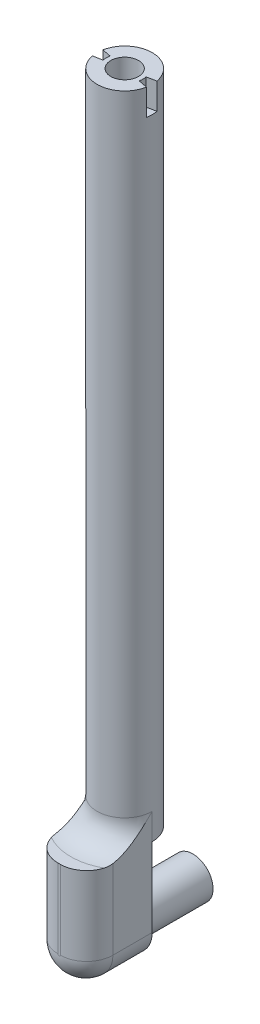
from build123d import *
from build123d.topology import SkipClean

# Parameters (mm, degrees)
SKETCH3_R           = 5.25
BOSS_EXTRUDE1_DEPTH = 120
BOSS_EXTRUDE4_DEPTH = 12.5
SKETCH6_R           = 3.85
BOSS_EXTRUDE5_DEPTH = 13
FILLET3_R           = 5
FILLET4_R           = 5
SKETCH7_R           = 2.65
CUT_EXTRUDE1_DEPTH  = 8
BOSS_EXTRUDE6_START = 5
BOSS_EXTRUDE6_DEPTH = 5


with BuildPart() as part:
    # Sketch3 → Boss-Extrude1 (new body)
    with BuildSketch(Plane(origin=(0, 0, 0), x_dir=(1, 0, 0), z_dir=(0, 1, 0))):
        with Locations(Location((0, 0, 0), (0, 0, 270))):
            Circle(SKETCH3_R)
    extrude(amount=BOSS_EXTRUDE1_DEPTH)

    # Sketch4 → Boss-Extrude4 (add)
    with BuildSketch(Plane.XY):
        with BuildLine():
            Line((-5.25, 0), (-5.25, -15))
            ThreePointArc((-5.25, -15), (0, -20.25), (5.25, -15))
            Line((5.25, -15), (5.25, 0))
            Line((5.25, 0), (-5.25, 0))
        make_face()
    extrude(amount=BOSS_EXTRUDE4_DEPTH)

    # Sketch6 → Boss-Extrude5 (add)
    with BuildSketch(Plane(origin=(0, 0, 0), x_dir=(-1, 0, 0), z_dir=(0, 0, -1))):
        with Locations(Location((0, -15, 0), (0, 0, 180))):
            Circle(SKETCH6_R)
    extrude(amount=BOSS_EXTRUDE5_DEPTH)

    # Fillet3
    # the kernel refuses this fillet: 5 mm, written as the material it adds along each edge
    with BuildSketch(Plane(origin=(0, 0, 0), x_dir=(0, 0, 1), z_dir=(-1, 0, 0))) as fillet3_piece_1_section:
        with BuildLine():
            CenterArc((5.25 + FILLET3_R, FILLET3_R), FILLET3_R, 180, 90)
            Line((5.25 + FILLET3_R, 0), (5.25, 0))
            Line((5.25, 0), (5.25, FILLET3_R))
        make_face()
    fillet3_piece_1 = revolve(axis=Axis((0, 0, 0), (0, 1, 0)), revolution_arc=90, mode=Mode.PRIVATE)
    fillet3_piece_1 = split(fillet3_piece_1, bisect_by=Plane(origin=(5.25, 1.168711495, 5.202443702), z_dir=(-1, 0, 0)), keep=Keep.TOP, mode=Mode.PRIVATE)
    add(fillet3_piece_1)
    with BuildSketch(Plane(origin=(0, 0, 0), x_dir=(-1, 0, 0), z_dir=(0, 0, -1))) as fillet3_piece_2_section:
        with BuildLine():
            CenterArc((5.25 + FILLET3_R, FILLET3_R), FILLET3_R, 180, 90)
            Line((5.25 + FILLET3_R, 0), (5.25, 0))
            Line((5.25, 0), (5.25, FILLET3_R))
        make_face()
    fillet3_piece_2 = revolve(axis=Axis((0, 0, 0), (0, 1, 0)), revolution_arc=90, mode=Mode.PRIVATE)
    fillet3_piece_2 = split(fillet3_piece_2, bisect_by=Plane(origin=(-5.25, 1.168711696, 5.202443347), z_dir=(1, 0, 0)), keep=Keep.TOP, mode=Mode.PRIVATE)
    add(fillet3_piece_2)

    # Fillet4
    fillet4_edges = [part.edges().sort_by_distance(p)[0] for p in [
        (5.25, -7.5, 12.5),
        (0, -20.25, 12.5),
        (-5.25, -7.5, 12.5),
    ]]
    fillet(fillet4_edges, radius=FILLET4_R)

    # Sketch7 → Cut-Extrude1 (cut)
    with BuildSketch(Plane(origin=(0, 120, 0), x_dir=(1, 0, 0), z_dir=(0, 1, 0))):
        with Locations(Location((0, 0, 0), (0, 0, 270))):
            Circle(SKETCH7_R)
    extrude(amount=-CUT_EXTRUDE1_DEPTH, mode=Mode.SUBTRACT)

    # Sketch9 → Boss-Extrude6 (add)
    with SkipClean():  # the faces are left unmerged after this step: merging them gives an invalid solid
        with BuildSketch(Plane(origin=(0, 120, 0), x_dir=(1, 0, 0), z_dir=(0, 1, 0)).offset(BOSS_EXTRUDE6_START)):
            with BuildLine():
                Line((-3.435921355, 0.666666667), (-5.153882032, 1))
                ThreePointArc((-5.153882032, 1), (0, 5.25), (5.153882032, 1))
                Line((5.153882032, 1), (3.435921355, 0.666666667))
                ThreePointArc((3.435921355, 0.666666667), (3.5, 0), (3.435921355, -0.666666667))
                Line((3.435921355, -0.666666667), (5.153882032, -1))
                ThreePointArc((5.153882032, -1), (0, -5.25), (-5.153882032, -1))
                Line((-5.153882032, -1), (-3.435921355, -0.666666667))
                ThreePointArc((-3.435921355, -0.666666667), (-3.5, 0), (-3.435921355, 0.666666667))
            make_face()
            with BuildLine():
                ThreePointArc((-2.601483311, 0.504761905), (0, 2.65), (2.601483311, 0.504761905))
                ThreePointArc((2.601483311, 0.504761905), (2.65, 0), (2.601483311, -0.504761905))
                ThreePointArc((2.601483311, -0.504761905), (0, -2.65), (-2.601483311, -0.504761905))
                ThreePointArc((-2.601483311, -0.504761905), (-2.65, 0), (-2.601483311, 0.504761905))
            make_face(mode=Mode.SUBTRACT)
        extrude(amount=-BOSS_EXTRUDE6_DEPTH)


solid = part.part
